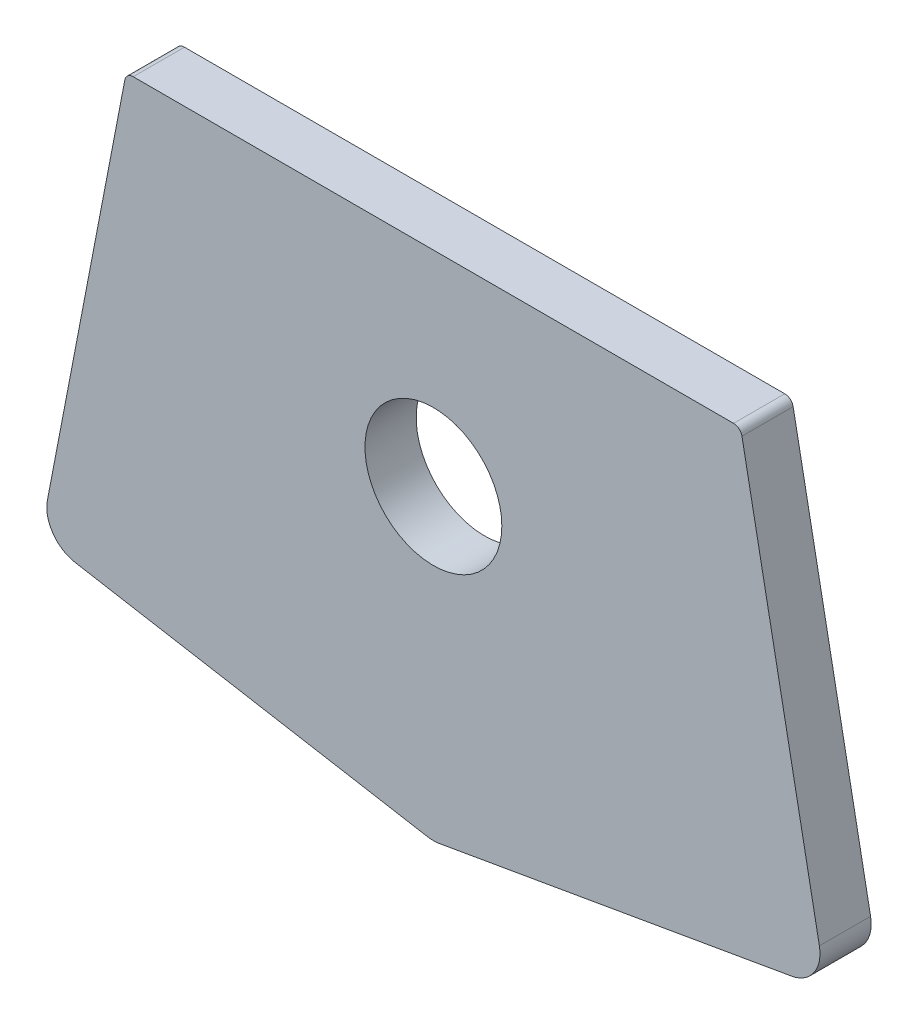
from build123d import *

# Parameters (mm, degrees)
SKETCH_1_R      = 4.01
EXTRUDE_1_DEPTH = 1.5
FILLET_1_R      = 2
FILLET_2_R      = 0.5


with BuildPart() as part:
    # 草图1 → 凸台-拉伸1 (new, symmetric)
    with BuildSketch(Plane.XY):
        Polygon((0, -30), (-23, -26), (-18, 0), (18, 0), (23, -26), align=None)
        with Locations((0, -12)):
            Circle(SKETCH_1_R, mode=Mode.SUBTRACT)
    extrude(amount=EXTRUDE_1_DEPTH, both=True)

    # 圆角1
    fillet_1_edges = [part.edges().sort_by_distance(p)[0] for p in [
        (23, -26, 0),
        (0, -30, 0),
        (-23, -26, 0),
    ]]
    fillet(fillet_1_edges, radius=FILLET_1_R)

    # 圆角2
    fillet_2_edges = [part.edges().sort_by_distance(p)[0] for p in [
        (18, 0, 0),
        (-18, 0, 0),
    ]]
    fillet(fillet_2_edges, radius=FILLET_2_R)


solid = part.part
